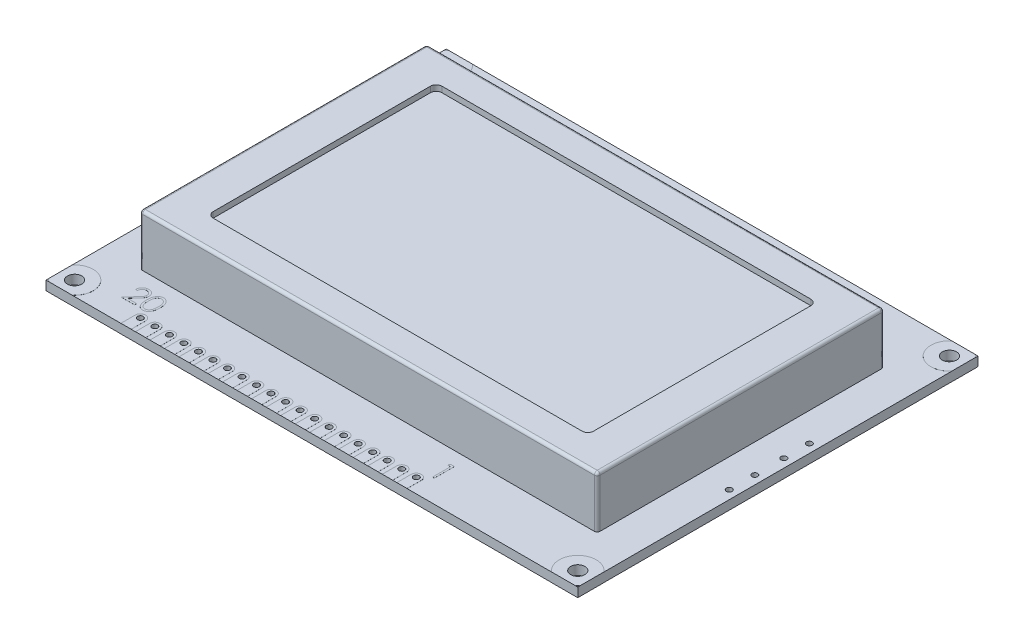
from build123d import *

# Parameters (mm, degrees)
SKETCH1_W                = 93
SKETCH1_H                = 70
SKETCH1_R                = 1.25
SKETCH1_R_2              = 0.5
BOSS_EXTRUDE1_DEPTH      = 1.6
BOSS_EXTRUDE2_DEPTH      = 1.61
BOSS_EXTRUDE2_DEPTH_BACK = 0.01
SKETCH4_R                = 0.5
SKETCH4_R_2              = 1.25
BOSS_EXTRUDE3_START      = 1.6
SKETCH5_W                = 80
SKETCH5_H                = 50.2
BOSS_EXTRUDE3_DEPTH      = 9
FILLET1_R                = 0.5
CUT_EXTRUDE1_START       = 10.6
CUT_EXTRUDE1_DEPTH       = 1
BOSS_EXTRUDE4_START      = 1.6
BOSS_EXTRUDE4_DEPTH      = 0.01
SKETCH8_R                = 7.5
BOSS_EXTRUDE5_DEPTH      = 3
FILLET2_R                = 9


with BuildPart() as part:
    # Sketch1 → Boss-Extrude1 (new body)
    with BuildSketch(Plane(origin=(0, 0, 0), x_dir=(1, 0, 0), z_dir=(0, 1, 0))):
        with Locations((46.5, 35)):
            Rectangle(SKETCH1_W, SKETCH1_H)
        with Locations(Location((2.5, 67.5, 0), (0, 0, 270))):
            Circle(SKETCH1_R, mode=Mode.SUBTRACT)
        with Locations(Location((90.5, 67.5, 0), (0, 0, 270))):
            Circle(SKETCH1_R, mode=Mode.SUBTRACT)
        with Locations(Location((90.5, 2.5, 0), (0, 0, 270))):
            Circle(SKETCH1_R, mode=Mode.SUBTRACT)
        with Locations(Location((2.5, 2.5, 0), (0, 0, 270))):
            Circle(SKETCH1_R, mode=Mode.SUBTRACT)
        with Locations(Location((14, 2.5, 0), (0, 0, 270))):
            Circle(SKETCH1_R_2, mode=Mode.SUBTRACT)
        with Locations(Location((16.54, 2.5, 0), (0, 0, 270))):
            Circle(SKETCH1_R_2, mode=Mode.SUBTRACT)
        with Locations(Location((19.08, 2.5, 0), (0, 0, 270))):
            Circle(SKETCH1_R_2, mode=Mode.SUBTRACT)
        with Locations(Location((21.62, 2.5, 0), (0, 0, 270))):
            Circle(SKETCH1_R_2, mode=Mode.SUBTRACT)
        with Locations(Location((24.16, 2.5, 0), (0, 0, 270))):
            Circle(SKETCH1_R_2, mode=Mode.SUBTRACT)
        with Locations(Location((26.7, 2.5, 0), (0, 0, 270))):
            Circle(SKETCH1_R_2, mode=Mode.SUBTRACT)
        with Locations(Location((29.24, 2.5, 0), (0, 0, 270))):
            Circle(SKETCH1_R_2, mode=Mode.SUBTRACT)
        with Locations(Location((31.78, 2.5, 0), (0, 0, 270))):
            Circle(SKETCH1_R_2, mode=Mode.SUBTRACT)
        with Locations(Location((34.32, 2.5, 0), (0, 0, 270))):
            Circle(SKETCH1_R_2, mode=Mode.SUBTRACT)
        with Locations(Location((36.86, 2.5, 0), (0, 0, 270))):
            Circle(SKETCH1_R_2, mode=Mode.SUBTRACT)
        with Locations(Location((39.4, 2.5, 0), (0, 0, 270))):
            Circle(SKETCH1_R_2, mode=Mode.SUBTRACT)
        with Locations(Location((41.94, 2.5, 0), (0, 0, 270))):
            Circle(SKETCH1_R_2, mode=Mode.SUBTRACT)
        with Locations(Location((44.48, 2.5, 0), (0, 0, 270))):
            Circle(SKETCH1_R_2, mode=Mode.SUBTRACT)
        with Locations(Location((47.02, 2.5, 0), (0, 0, 270))):
            Circle(SKETCH1_R_2, mode=Mode.SUBTRACT)
        with Locations(Location((49.56, 2.5, 0), (0, 0, 270))):
            Circle(SKETCH1_R_2, mode=Mode.SUBTRACT)
        with Locations(Location((52.1, 2.5, 0), (0, 0, 270))):
            Circle(SKETCH1_R_2, mode=Mode.SUBTRACT)
        with Locations(Location((54.64, 2.5, 0), (0, 0, 270))):
            Circle(SKETCH1_R_2, mode=Mode.SUBTRACT)
        with Locations(Location((57.18, 2.5, 0), (0, 0, 270))):
            Circle(SKETCH1_R_2, mode=Mode.SUBTRACT)
        with Locations(Location((59.72, 2.5, 0), (0, 0, 270))):
            Circle(SKETCH1_R_2, mode=Mode.SUBTRACT)
        with Locations(Location((62.26, 2.5, 0), (0, 0, 270))):
            Circle(SKETCH1_R_2, mode=Mode.SUBTRACT)
        with Locations(Location((91.5, 42, 0), (0, 0, 270))):
            Circle(SKETCH1_R_2, mode=Mode.SUBTRACT)
        with Locations(Location((91.5, 37.54, 0), (0, 0, 270))):
            Circle(SKETCH1_R_2, mode=Mode.SUBTRACT)
        with Locations(Location((91.5, 32.46, 0), (0, 0, 270))):
            Circle(SKETCH1_R_2, mode=Mode.SUBTRACT)
        with Locations(Location((91.5, 28, 0), (0, 0, 270))):
            Circle(SKETCH1_R_2, mode=Mode.SUBTRACT)
    extrude(amount=BOSS_EXTRUDE1_DEPTH)

    # Sketch4 → Boss-Extrude2 (add, two sides: drawn at the far end of the back side and taken through both)
    # profile 1 of 24: a face of its own
    with BuildSketch(Plane(origin=(0, 0, 0), x_dir=(1, 0, 0), z_dir=(0, 1, 0)).offset(-BOSS_EXTRUDE2_DEPTH_BACK)):
        with BuildLine():
            Line((13.1, 2.5), (13.1, 0))
            Line((13.1, 0), (14.9, 0))
            Line((14.9, 0), (14.9, 2.5))
            ThreePointArc((14.9, 2.5), (14, 3.4), (13.1, 2.5))
        make_face()
        with Locations(Location((14, 2.5, 0), (0, 0, 270))):
            Circle(SKETCH4_R, mode=Mode.SUBTRACT)
    # profile 2 of 24: a face of its own
    with BuildSketch(Plane(origin=(0, 0, 0), x_dir=(1, 0, 0), z_dir=(0, 1, 0)).offset(-BOSS_EXTRUDE2_DEPTH_BACK)):
        with BuildLine():
            Line((15.64, 2.5), (15.64, 0))
            Line((15.64, 0), (17.44, 0))
            Line((17.44, 0), (17.44, 2.5))
            ThreePointArc((17.44, 2.5), (16.54, 3.4), (15.64, 2.5))
        make_face()
        with Locations(Location((16.54, 2.5, 0), (0, 0, 270))):
            Circle(SKETCH4_R, mode=Mode.SUBTRACT)
    # profile 3 of 24: a face of its own
    with BuildSketch(Plane(origin=(0, 0, 0), x_dir=(1, 0, 0), z_dir=(0, 1, 0)).offset(-BOSS_EXTRUDE2_DEPTH_BACK)):
        with BuildLine():
            Line((18.18, 2.5), (18.18, 0))
            Line((18.18, 0), (19.98, 0))
            Line((19.98, 0), (19.98, 2.5))
            ThreePointArc((19.98, 2.5), (19.08, 3.4), (18.18, 2.5))
        make_face()
        with Locations(Location((19.08, 2.5, 0), (0, 0, 270))):
            Circle(SKETCH4_R, mode=Mode.SUBTRACT)
    # profile 4 of 24: a face of its own
    with BuildSketch(Plane(origin=(0, 0, 0), x_dir=(1, 0, 0), z_dir=(0, 1, 0)).offset(-BOSS_EXTRUDE2_DEPTH_BACK)):
        with BuildLine():
            Line((20.72, 2.5), (20.72, 0))
            Line((20.72, 0), (22.52, 0))
            Line((22.52, 0), (22.52, 2.5))
            ThreePointArc((22.52, 2.5), (21.62, 3.4), (20.72, 2.5))
        make_face()
        with Locations(Location((21.62, 2.5, 0), (0, 0, 270))):
            Circle(SKETCH4_R, mode=Mode.SUBTRACT)
    # profile 5 of 24: a face of its own
    with BuildSketch(Plane(origin=(0, 0, 0), x_dir=(1, 0, 0), z_dir=(0, 1, 0)).offset(-BOSS_EXTRUDE2_DEPTH_BACK)):
        with BuildLine():
            Line((23.26, 2.5), (23.26, 0))
            Line((23.26, 0), (25.06, 0))
            Line((25.06, 0), (25.06, 2.5))
            ThreePointArc((25.06, 2.5), (24.16, 3.4), (23.26, 2.5))
        make_face()
        with Locations(Location((24.16, 2.5, 0), (0, 0, 270))):
            Circle(SKETCH4_R, mode=Mode.SUBTRACT)
    # profile 6 of 24: a face of its own
    with BuildSketch(Plane(origin=(0, 0, 0), x_dir=(1, 0, 0), z_dir=(0, 1, 0)).offset(-BOSS_EXTRUDE2_DEPTH_BACK)):
        with BuildLine():
            Line((25.8, 2.5), (25.8, 0))
            Line((25.8, 0), (27.6, 0))
            Line((27.6, 0), (27.6, 2.5))
            ThreePointArc((27.6, 2.5), (26.7, 3.4), (25.8, 2.5))
        make_face()
        with Locations(Location((26.7, 2.5, 0), (0, 0, 270))):
            Circle(SKETCH4_R, mode=Mode.SUBTRACT)
    # profile 7 of 24: a face of its own
    with BuildSketch(Plane(origin=(0, 0, 0), x_dir=(1, 0, 0), z_dir=(0, 1, 0)).offset(-BOSS_EXTRUDE2_DEPTH_BACK)):
        with BuildLine():
            Line((28.34, 2.5), (28.34, 0))
            Line((28.34, 0), (30.14, 0))
            Line((30.14, 0), (30.14, 2.5))
            ThreePointArc((30.14, 2.5), (29.24, 3.4), (28.34, 2.5))
        make_face()
        with Locations(Location((29.24, 2.5, 0), (0, 0, 270))):
            Circle(SKETCH4_R, mode=Mode.SUBTRACT)
    # profile 8 of 24: a face of its own
    with BuildSketch(Plane(origin=(0, 0, 0), x_dir=(1, 0, 0), z_dir=(0, 1, 0)).offset(-BOSS_EXTRUDE2_DEPTH_BACK)):
        with BuildLine():
            Line((30.88, 2.5), (30.88, 0))
            Line((30.88, 0), (32.68, 0))
            Line((32.68, 0), (32.68, 2.5))
            ThreePointArc((32.68, 2.5), (31.78, 3.4), (30.88, 2.5))
        make_face()
        with Locations(Location((31.78, 2.5, 0), (0, 0, 270))):
            Circle(SKETCH4_R, mode=Mode.SUBTRACT)
    # profile 9 of 24: a face of its own
    with BuildSketch(Plane(origin=(0, 0, 0), x_dir=(1, 0, 0), z_dir=(0, 1, 0)).offset(-BOSS_EXTRUDE2_DEPTH_BACK)):
        with BuildLine():
            Line((33.42, 2.5), (33.42, 0))
            Line((33.42, 0), (35.22, 0))
            Line((35.22, 0), (35.22, 2.5))
            ThreePointArc((35.22, 2.5), (34.32, 3.4), (33.42, 2.5))
        make_face()
        with Locations(Location((34.32, 2.5, 0), (0, 0, 270))):
            Circle(SKETCH4_R, mode=Mode.SUBTRACT)
    # profile 10 of 24: a face of its own
    with BuildSketch(Plane(origin=(0, 0, 0), x_dir=(1, 0, 0), z_dir=(0, 1, 0)).offset(-BOSS_EXTRUDE2_DEPTH_BACK)):
        with BuildLine():
            Line((35.96, 2.5), (35.96, 0))
            Line((35.96, 0), (37.76, 0))
            Line((37.76, 0), (37.76, 2.5))
            ThreePointArc((37.76, 2.5), (36.86, 3.4), (35.96, 2.5))
        make_face()
        with Locations(Location((36.86, 2.5, 0), (0, 0, 270))):
            Circle(SKETCH4_R, mode=Mode.SUBTRACT)
    # profile 11 of 24: a face of its own
    with BuildSketch(Plane(origin=(0, 0, 0), x_dir=(1, 0, 0), z_dir=(0, 1, 0)).offset(-BOSS_EXTRUDE2_DEPTH_BACK)):
        with BuildLine():
            Line((38.5, 2.5), (38.5, 0))
            Line((38.5, 0), (40.3, 0))
            Line((40.3, 0), (40.3, 2.5))
            ThreePointArc((40.3, 2.5), (39.4, 3.4), (38.5, 2.5))
        make_face()
        with Locations(Location((39.4, 2.5, 0), (0, 0, 270))):
            Circle(SKETCH4_R, mode=Mode.SUBTRACT)
    # profile 12 of 24: a face of its own
    with BuildSketch(Plane(origin=(0, 0, 0), x_dir=(1, 0, 0), z_dir=(0, 1, 0)).offset(-BOSS_EXTRUDE2_DEPTH_BACK)):
        with BuildLine():
            Line((41.04, 2.5), (41.04, 0))
            Line((41.04, 0), (42.84, 0))
            Line((42.84, 0), (42.84, 2.5))
            ThreePointArc((42.84, 2.5), (41.94, 3.4), (41.04, 2.5))
        make_face()
        with Locations(Location((41.94, 2.5, 0), (0, 0, 270))):
            Circle(SKETCH4_R, mode=Mode.SUBTRACT)
    # profile 13 of 24: a face of its own
    with BuildSketch(Plane(origin=(0, 0, 0), x_dir=(1, 0, 0), z_dir=(0, 1, 0)).offset(-BOSS_EXTRUDE2_DEPTH_BACK)):
        with BuildLine():
            Line((43.58, 2.5), (43.58, 0))
            Line((43.58, 0), (45.38, 0))
            Line((45.38, 0), (45.38, 2.5))
            ThreePointArc((45.38, 2.5), (44.48, 3.4), (43.58, 2.5))
        make_face()
        with Locations(Location((44.48, 2.5, 0), (0, 0, 270))):
            Circle(SKETCH4_R, mode=Mode.SUBTRACT)
    # profile 14 of 24: a face of its own
    with BuildSketch(Plane(origin=(0, 0, 0), x_dir=(1, 0, 0), z_dir=(0, 1, 0)).offset(-BOSS_EXTRUDE2_DEPTH_BACK)):
        with BuildLine():
            Line((46.12, 2.5), (46.12, 0))
            Line((46.12, 0), (47.92, 0))
            Line((47.92, 0), (47.92, 2.5))
            ThreePointArc((47.92, 2.5), (47.02, 3.4), (46.12, 2.5))
        make_face()
        with Locations(Location((47.02, 2.5, 0), (0, 0, 270))):
            Circle(SKETCH4_R, mode=Mode.SUBTRACT)
    # profile 15 of 24: a face of its own
    with BuildSketch(Plane(origin=(0, 0, 0), x_dir=(1, 0, 0), z_dir=(0, 1, 0)).offset(-BOSS_EXTRUDE2_DEPTH_BACK)):
        with BuildLine():
            Line((48.66, 2.5), (48.66, 0))
            Line((48.66, 0), (50.46, 0))
            Line((50.46, 0), (50.46, 2.5))
            ThreePointArc((50.46, 2.5), (49.56, 3.4), (48.66, 2.5))
        make_face()
        with Locations(Location((49.56, 2.5, 0), (0, 0, 270))):
            Circle(SKETCH4_R, mode=Mode.SUBTRACT)
    # profile 16 of 24: a face of its own
    with BuildSketch(Plane(origin=(0, 0, 0), x_dir=(1, 0, 0), z_dir=(0, 1, 0)).offset(-BOSS_EXTRUDE2_DEPTH_BACK)):
        with BuildLine():
            Line((51.2, 2.5), (51.2, 0))
            Line((51.2, 0), (53, 0))
            Line((53, 0), (53, 2.5))
            ThreePointArc((53, 2.5), (52.1, 3.4), (51.2, 2.5))
        make_face()
        with Locations(Location((52.1, 2.5, 0), (0, 0, 270))):
            Circle(SKETCH4_R, mode=Mode.SUBTRACT)
    # profile 17 of 24: a face of its own
    with BuildSketch(Plane(origin=(0, 0, 0), x_dir=(1, 0, 0), z_dir=(0, 1, 0)).offset(-BOSS_EXTRUDE2_DEPTH_BACK)):
        with BuildLine():
            Line((53.74, 2.5), (53.74, 0))
            Line((53.74, 0), (55.54, 0))
            Line((55.54, 0), (55.54, 2.5))
            ThreePointArc((55.54, 2.5), (54.64, 3.4), (53.74, 2.5))
        make_face()
        with Locations(Location((54.64, 2.5, 0), (0, 0, 270))):
            Circle(SKETCH4_R, mode=Mode.SUBTRACT)
    # profile 18 of 24: a face of its own
    with BuildSketch(Plane(origin=(0, 0, 0), x_dir=(1, 0, 0), z_dir=(0, 1, 0)).offset(-BOSS_EXTRUDE2_DEPTH_BACK)):
        with BuildLine():
            Line((56.28, 2.5), (56.28, 0))
            Line((56.28, 0), (58.08, 0))
            Line((58.08, 0), (58.08, 2.5))
            ThreePointArc((58.08, 2.5), (57.18, 3.4), (56.28, 2.5))
        make_face()
        with Locations(Location((57.18, 2.5, 0), (0, 0, 270))):
            Circle(SKETCH4_R, mode=Mode.SUBTRACT)
    # profile 19 of 24: a face of its own
    with BuildSketch(Plane(origin=(0, 0, 0), x_dir=(1, 0, 0), z_dir=(0, 1, 0)).offset(-BOSS_EXTRUDE2_DEPTH_BACK)):
        with BuildLine():
            Line((58.82, 2.5), (58.82, 0))
            Line((58.82, 0), (60.62, 0))
            Line((60.62, 0), (60.62, 2.5))
            ThreePointArc((60.62, 2.5), (59.72, 3.4), (58.82, 2.5))
        make_face()
        with Locations(Location((59.72, 2.5, 0), (0, 0, 270))):
            Circle(SKETCH4_R, mode=Mode.SUBTRACT)
    # profile 20 of 24: a face of its own
    with BuildSketch(Plane(origin=(0, 0, 0), x_dir=(1, 0, 0), z_dir=(0, 1, 0)).offset(-BOSS_EXTRUDE2_DEPTH_BACK)):
        with BuildLine():
            Line((61.36, 2.5), (61.36, 0))
            Line((61.36, 0), (63.16, 0))
            Line((63.16, 0), (63.16, 2.5))
            ThreePointArc((63.16, 2.5), (62.26, 3.4), (61.36, 2.5))
        make_face()
        with Locations(Location((62.26, 2.5, 0), (0, 0, 270))):
            Circle(SKETCH4_R, mode=Mode.SUBTRACT)
    # profile 21 of 24: a face of its own
    with BuildSketch(Plane(origin=(0, 0, 0), x_dir=(1, 0, 0), z_dir=(0, 1, 0)).offset(-BOSS_EXTRUDE2_DEPTH_BACK)):
        with BuildLine():
            Line((0, 4.576655966), (0, 0.423344034))
            ThreePointArc((0, 0.423344034), (0.201902961, 0.201902961), (0.423344034, 0))
            Line((0.423344034, 0), (4.576655966, 0))
            ThreePointArc((4.576655966, 0), (4.798097039, 4.798097039), (0, 4.576655966))
        make_face()
        with Locations(Location((2.5, 2.5, 0), (0, 0, 270))):
            Circle(SKETCH4_R_2, mode=Mode.SUBTRACT)
    # profile 22 of 24: a face of its own
    with BuildSketch(Plane(origin=(0, 0, 0), x_dir=(1, 0, 0), z_dir=(0, 1, 0)).offset(-BOSS_EXTRUDE2_DEPTH_BACK)):
        with BuildLine():
            Line((4.576655966, 70), (0.423344034, 70))
            ThreePointArc((0.423344034, 70), (0.201902961, 69.798097039), (0, 69.576655966))
            Line((0, 69.576655966), (0, 65.423344034))
            ThreePointArc((0, 65.423344034), (4.798097039, 65.201902961), (4.576655966, 70))
        make_face()
        with Locations(Location((2.5, 67.5, 0), (0, 0, 270))):
            Circle(SKETCH4_R_2, mode=Mode.SUBTRACT)
    # profile 23 of 24: a face of its own
    with BuildSketch(Plane(origin=(0, 0, 0), x_dir=(1, 0, 0), z_dir=(0, 1, 0)).offset(-BOSS_EXTRUDE2_DEPTH_BACK)):
        with BuildLine():
            Line((88.423344034, 70), (92.576655966, 70))
            ThreePointArc((92.576655966, 70), (92.798097039, 69.798097039), (93, 69.576655966))
            Line((93, 69.576655966), (93, 65.423344034))
            ThreePointArc((93, 65.423344034), (88.201902961, 65.201902961), (88.423344034, 70))
        make_face()
        with Locations(Location((90.5, 67.5, 0), (0, 0, 270))):
            Circle(SKETCH4_R_2, mode=Mode.SUBTRACT)
    # profile 24 of 24: a face of its own
    with BuildSketch(Plane(origin=(0, 0, 0), x_dir=(1, 0, 0), z_dir=(0, 1, 0)).offset(-BOSS_EXTRUDE2_DEPTH_BACK)):
        with BuildLine():
            Line((88.423344034, 0), (92.576655966, 0))
            ThreePointArc((92.576655966, 0), (92.798097039, 0.201902961), (93, 0.423344034))
            Line((93, 0.423344034), (93, 4.576655966))
            ThreePointArc((93, 4.576655966), (88.201902961, 4.798097039), (88.423344034, 0))
        make_face()
        with Locations(Location((90.5, 2.5, 0), (0, 0, 270))):
            Circle(SKETCH4_R_2, mode=Mode.SUBTRACT)
    extrude(amount=BOSS_EXTRUDE2_DEPTH + BOSS_EXTRUDE2_DEPTH_BACK)

    # Sketch5 → Boss-Extrude3 (add)
    with BuildSketch(Plane(origin=(0, 0, 0), x_dir=(1, 0, 0), z_dir=(0, 1, 0)).offset(BOSS_EXTRUDE3_START)):
        with Locations((46.5, 35)):
            Rectangle(SKETCH5_W, SKETCH5_H)
    extrude(amount=BOSS_EXTRUDE3_DEPTH)

    # Fillet1
    fillet1_edges = [part.edges().sort_by_distance(p)[0] for p in [
        (6.5, 6.1, -9.9),
        (86.5, 6.1, -9.9),
        (86.5, 6.1, -60.1),
        (6.5, 6.1, -60.1),
        (46.5, 10.6, -9.9),
        (86.5, 10.6, -35),
        (46.5, 10.6, -60.1),
        (6.5, 10.6, -35),
    ]]
    fillet(fillet1_edges, radius=FILLET1_R)

    # Sketch6 → Cut-Extrude1 (cut)
    with BuildSketch(Plane(origin=(0, 0, 0), x_dir=(1, 0, 0), z_dir=(0, 1, 0)).offset(CUT_EXTRUDE1_START)):
        with BuildLine():
            Line((14.24, 55), (78.76, 55))
            ThreePointArc((78.76, 55), (79.467106781, 54.707106781), (79.76, 54))
            Line((79.76, 54), (79.76, 16))
            ThreePointArc((79.76, 16), (79.467106781, 15.292893219), (78.76, 15))
            Line((78.76, 15), (14.24, 15))
            ThreePointArc((14.24, 15), (13.532893219, 15.292893219), (13.24, 16))
            Line((13.24, 16), (13.24, 54))
            ThreePointArc((13.24, 54), (13.532893219, 54.707106781), (14.24, 55))
        make_face()
    extrude(amount=-CUT_EXTRUDE1_DEPTH, mode=Mode.SUBTRACT)

    # Sketch7 → Boss-Extrude4 (add)
    # profile 1 of 3: a face of its own
    with BuildSketch(Plane(origin=(0, 0, 0), x_dir=(1, 0, 0), z_dir=(0, 1, 0)).offset(BOSS_EXTRUDE4_START)):
        Polygon((63.31493189, 7.465834386), (63.962067306, 7.465834386), (63.962067306, 3.965834386), (63.647964742, 3.965834386), (63.647964742, 7.106860027), (63.109503204, 7.106860027), align=None)
    # profile 2 of 3: a face of its own
    with BuildSketch(Plane(origin=(0, 0, 0), x_dir=(1, 0, 0), z_dir=(0, 1, 0)).offset(BOSS_EXTRUDE4_START)):
        with BuildLine():
            Line((9.57822358, 6.421604631), (9.264121016, 6.421604631))
            add(Edge.make_bspline(
                [(9.264121016, 6.421604631), (9.266168169, 6.463275519), (9.270188723, 6.545116033), (9.289017012, 6.66443994), (9.315957889, 6.778494738), (9.354049343, 6.886364652), (9.401355621, 6.98900346), (9.458085649, 7.086003475), (9.525279499, 7.176994664), (9.601486233, 7.261133507), (9.684254872, 7.338321078), (9.773560812, 7.404976321), (9.867405839, 7.461293992), (9.965505238, 7.508375234), (10.068965801, 7.54371508), (10.176848659, 7.56993672), (10.289627796, 7.585713065), (10.366467818, 7.587408851), (10.405547298, 7.588271298)],
                knots=[0, 0, 0, 0, 1.10065271, 2.161652631, 3.183658789, 4.190468796, 5.17591951, 6.163126047, 7.15150782, 8.156236427, 9.156009102, 10.134482811, 11.092018607, 12.041330605, 13.001268258, 13.972401359, 14.968799086, 16, 16, 16, 16], degree=3))
            add(Edge.make_bspline(
                [(10.405547298, 7.588271298), (10.443925372, 7.587372841), (10.519336917, 7.585607406), (10.629398931, 7.570446377), (10.734176226, 7.546700786), (10.833463992, 7.513385369), (10.926470057, 7.468600942), (11.013893101, 7.414803403), (11.096773912, 7.352583572), (11.171380696, 7.279329758), (11.239888775, 7.201127374), (11.29899103, 7.11763947), (11.349604194, 7.031410185), (11.391791873, 6.941781983), (11.422848012, 6.847910955), (11.44642622, 6.751163752), (11.459753634, 6.650538941), (11.461799058, 6.582432385), (11.462838965, 6.547806554)],
                knots=[0, 0, 0, 0, 1.111607364, 2.184268762, 3.212621178, 4.221274766, 5.211760367, 6.196651075, 7.1921475, 8.207485113, 9.220403448, 10.201281604, 11.166441695, 12.114753415, 13.065576456, 14.026450734, 14.996634279, 16, 16, 16, 16], degree=3))
            add(Edge.make_bspline(
                [(11.462838965, 6.547806554), (11.461145702, 6.49905872), (11.45778889, 6.402418506), (11.429074514, 6.260403643), (11.384228003, 6.122810224), (11.330230646, 6.012072922), (11.275758202, 5.922839428), (11.226670694, 5.849370723), (11.169205883, 5.770265255), (11.102527385, 5.685787917), (11.028014513, 5.595277012), (10.94499235, 5.498787217), (10.852868868, 5.397315447), (10.788210367, 5.328009846), (10.754705952, 5.292097419)],
                knots=[0, 0, 0, 0, 1.184426356, 2.348067706, 3.509069118, 4.696110526, 5.333549288, 6.050745305, 6.844228056, 7.710549037, 8.667450064, 9.695053472, 10.805634456, 12, 12, 12, 12], degree=3))
            Line((10.754705952, 5.292097419), (9.87900483, 4.357502067))
            Line((9.87900483, 4.357502067), (11.50771076, 4.357502067))
            Line((11.50771076, 4.357502067), (11.50771076, 3.998527708))
            Line((11.50771076, 3.998527708), (9.129505631, 3.998527708))
            Line((9.129505631, 3.998527708), (10.486877426, 5.447045336))
            add(Edge.make_bspline(
                [(10.486877426, 5.447045336), (10.519925313, 5.481543643), (10.58340354, 5.547807829), (10.673186117, 5.644550789), (10.753825105, 5.73430033), (10.825842498, 5.816886879), (10.887676003, 5.893518446), (10.942548235, 5.96171315), (10.986513826, 6.0244676), (11.034229222, 6.097208214), (11.080443203, 6.186020531), (11.120155559, 6.294554221), (11.144370408, 6.406281473), (11.147275243, 6.48178351), (11.148736401, 6.519761682)],
                knots=[0, 0, 0, 0, 1.329631726, 2.553950428, 3.673215718, 4.687767853, 5.603093632, 6.413772471, 7.123043292, 7.734684054, 8.834405432, 9.900288307, 10.943827018, 12, 12, 12, 12], degree=3))
            add(Edge.make_bspline(
                [(11.148736401, 6.519761682), (11.148100658, 6.543643081), (11.146847732, 6.590708731), (11.135790035, 6.65971449), (11.119079529, 6.726279304), (11.095134271, 6.790607923), (11.063527531, 6.852053575), (11.025054151, 6.910691055), (10.980664087, 6.96738002), (10.929312818, 7.020533319), (10.872901298, 7.069214524), (10.813307048, 7.112338609), (10.750256944, 7.14837772), (10.684016822, 7.177921217), (10.614771353, 7.201096599), (10.542386608, 7.217155178), (10.467062591, 7.227237662), (10.415629096, 7.228601834), (10.389421497, 7.229296939)],
                knots=[0, 0, 0, 0, 0.991446411, 1.95395049, 2.89581595, 3.838931463, 4.798493298, 5.75982156, 6.748411868, 7.785213223, 8.824556874, 9.840280684, 10.836137867, 11.835679398, 12.848801643, 13.863922112, 14.911575587, 16, 16, 16, 16], degree=3))
            add(Edge.make_bspline(
                [(10.389421497, 7.229296939), (10.362050664, 7.228581906), (10.308298868, 7.227177701), (10.229379835, 7.217355037), (10.154094057, 7.200409197), (10.082252154, 7.177232522), (10.013732568, 7.147773974), (9.948868524, 7.111082229), (9.887805635, 7.067298736), (9.830429112, 7.017658179), (9.777565133, 6.962390578), (9.731118257, 6.900780615), (9.690534243, 6.8339532), (9.655125009, 6.762088649), (9.626369319, 6.684534869), (9.604396169, 6.601567164), (9.587009322, 6.513545783), (9.581200801, 6.452760698), (9.57822358, 6.421604631)],
                knots=[0, 0, 0, 0, 1.031018746, 2.02475058, 2.990194455, 3.934040569, 4.864654155, 5.795059489, 6.735614925, 7.690564532, 8.649604399, 9.611025574, 10.590972636, 11.591080095, 12.624614302, 13.701020113, 14.821632451, 16, 16, 16, 16], degree=3))
        make_face()
    # profile 3 of 3: a face of its own
    with BuildSketch(Plane(origin=(0, 0, 0), x_dir=(1, 0, 0), z_dir=(0, 1, 0)).offset(BOSS_EXTRUDE4_START)):
        with BuildLine():
            add(Edge.make_bspline(
                [(11.821813324, 5.747125464), (11.822141342, 5.803222852), (11.822778522, 5.912192836), (11.829866943, 6.070977478), (11.841642285, 6.219937767), (11.857779658, 6.359080833), (11.877417638, 6.488442598), (11.903633125, 6.607677355), (11.933445927, 6.717336962), (11.967998373, 6.81777901), (12.006986162, 6.910356713), (12.049420423, 6.996781914), (12.096985217, 7.076923847), (12.14696213, 7.152061637), (12.201374202, 7.220965332), (12.258672992, 7.284607995), (12.321094869, 7.341518745), (12.386517877, 7.393365047), (12.455534341, 7.438814519), (12.526177007, 7.478847258), (12.598932113, 7.513047125), (12.673998296, 7.539937561), (12.750700854, 7.562148408), (12.829307921, 7.577337355), (12.909949285, 7.586894264), (12.964380719, 7.587807931), (12.991985599, 7.588271298)],
                knots=[0, 0, 0, 0, 1.646270934, 3.197905019, 4.663502075, 6.030701355, 7.308322542, 8.50163776, 9.611534131, 10.641858119, 11.616356847, 12.558055219, 13.465016945, 14.349605745, 15.204443733, 16.039544428, 16.859896111, 17.680448484, 18.487036065, 19.28249412, 20.06191084, 20.843045899, 21.620316918, 22.403196591, 23.190181807, 24, 24, 24, 24], degree=3))
            add(Edge.make_bspline(
                [(12.991985599, 7.588271298), (13.019821078, 7.587783483), (13.075177087, 7.586813372), (13.157017462, 7.577489429), (13.236967144, 7.562018306), (13.314685282, 7.540097331), (13.390810269, 7.512901655), (13.464746676, 7.478814538), (13.536953758, 7.43913567), (13.606284046, 7.392511793), (13.673498661, 7.340529517), (13.736946624, 7.281766848), (13.79663371, 7.216817129), (13.853309015, 7.146375265), (13.905364612, 7.06909018), (13.954938045, 6.98630607), (13.999310081, 6.896575205), (14.042044756, 6.801394738), (14.078931742, 6.698131079), (14.112197988, 6.587366318), (14.139076956, 6.467792131), (14.161466229, 6.340035886), (14.178811125, 6.203628403), (14.191443767, 6.058862087), (14.198116852, 5.905641697), (14.199373553, 5.800883847), (14.200018452, 5.747125464)],
                knots=[0, 0, 0, 0, 0.810914788, 1.612654377, 2.396697861, 3.181598691, 3.963628158, 4.749916497, 5.551656086, 6.361998678, 7.18212741, 8.025565596, 8.878627764, 9.750805457, 10.657531673, 11.591944965, 12.560506719, 13.57287815, 14.630710178, 15.753379473, 16.941251878, 18.199788006, 19.531962791, 20.947069417, 22.433333509, 24, 24, 24, 24], degree=3))
            add(Edge.make_bspline(
                [(14.200018452, 5.747125464), (14.199366867, 5.693601556), (14.198097281, 5.589312405), (14.191518575, 5.436781429), (14.178559943, 5.292783386), (14.162349955, 5.156972923), (14.139898992, 5.029915305), (14.112293826, 4.911170856), (14.081643503, 4.800226785), (14.043808709, 4.697991973), (14.002397999, 4.60304025), (13.957342802, 4.514373102), (13.909072976, 4.431206809), (13.856484231, 4.354207062), (13.800430818, 4.282828405), (13.739713029, 4.218330782), (13.676042444, 4.15916011), (13.608630028, 4.106508483), (13.538218477, 4.060423678), (13.4662594, 4.019209828), (13.391476017, 3.985977133), (13.315563064, 3.957442092), (13.237434698, 3.93564164), (13.157188307, 3.920567784), (13.075232071, 3.909995936), (13.019830506, 3.909189456), (12.991985599, 3.908784118)],
                knots=[0, 0, 0, 0, 1.561518951, 3.042555995, 4.452378317, 5.7783523, 7.031515105, 8.214008947, 9.334062868, 10.386615937, 11.391082383, 12.354592575, 13.286541444, 14.194233754, 15.072674879, 15.931287219, 16.775624067, 17.606195743, 18.42308326, 19.229000347, 20.022332153, 20.807536673, 21.593273796, 22.3848459, 23.188221202, 24, 24, 24, 24], degree=3))
            add(Edge.make_bspline(
                [(12.991985599, 3.908784118), (12.964381485, 3.909250474), (12.909951561, 3.910170036), (12.829299135, 3.919683767), (12.751016692, 3.93497927), (12.674717938, 3.956395874), (12.600011423, 3.982610711), (12.527915136, 4.016764394), (12.457627452, 4.056098463), (12.389335896, 4.100893885), (12.324323735, 4.152215568), (12.26222513, 4.208979857), (12.204600111, 4.272603268), (12.150966015, 4.342081191), (12.099991927, 4.416774433), (12.053102554, 4.497702806), (12.009731699, 4.584545417), (11.970088209, 4.677863327), (11.934939545, 4.779018255), (11.903891837, 4.889167434), (11.87937768, 5.00928307), (11.858394724, 5.138400437), (11.841470341, 5.277074367), (11.829916016, 5.425380146), (11.822774701, 5.583225355), (11.822139631, 5.691495129), (11.821813324, 5.747125464)],
                knots=[0, 0, 0, 0, 0.810891512, 1.598919785, 2.382837074, 3.152667961, 3.926044502, 4.706494248, 5.493654104, 6.291793342, 7.103789334, 7.925228297, 8.761435821, 9.622817696, 10.50288917, 11.416980706, 12.369136599, 13.353924996, 14.394355917, 15.514179734, 16.714354668, 17.994756427, 19.357759367, 20.818452758, 22.365282078, 24, 24, 24, 24], degree=3))
        make_face()
        with BuildLine():
            add(Edge.make_bspline(
                [(12.135915888, 5.748527708), (12.136035335, 5.701779009), (12.136267158, 5.611048964), (12.142323359, 5.479205703), (12.150573591, 5.356235375), (12.161214888, 5.241981838), (12.177017836, 5.136831826), (12.194724624, 5.040062143), (12.216272714, 4.952184905), (12.241767732, 4.872597095), (12.270806829, 4.799948026), (12.302512692, 4.732346811), (12.336573415, 4.668994875), (12.374692566, 4.610461266), (12.416207629, 4.556555102), (12.460180888, 4.50632227), (12.508253472, 4.461525289), (12.574757215, 4.407798433), (12.662553689, 4.3522793), (12.773174145, 4.30393321), (12.886842595, 4.273550754), (12.963993846, 4.269686998), (13.002502426, 4.267758477)],
                knots=[0, 0, 0, 0, 1.459021318, 2.831673884, 4.118529203, 5.306027144, 6.411944654, 7.436330062, 8.375795394, 9.233974572, 10.042671642, 10.816086306, 11.563610507, 12.285937304, 12.993564865, 13.685989202, 14.367179055, 15.041617293, 16.353048772, 17.594441528, 18.799311195, 20, 20, 20, 20], degree=3))
            add(Edge.make_bspline(
                [(13.002502426, 4.267758477), (13.041260098, 4.269356258), (13.118695421, 4.272548521), (13.231829216, 4.303347258), (13.341659486, 4.349816798), (13.427731427, 4.404764303), (13.49321397, 4.457092632), (13.54013096, 4.501707281), (13.583193009, 4.551663148), (13.624035083, 4.605562444), (13.661494159, 4.664434928), (13.695557297, 4.727997503), (13.726640644, 4.796426681), (13.74434969, 4.84419642), (13.753403868, 4.868619855)],
                knots=[0, 0, 0, 0, 1.353760809, 2.704726607, 4.075137775, 5.516104923, 6.260822281, 7.007110065, 7.778089737, 8.566572457, 9.372053459, 10.217411131, 11.088608312, 12, 12, 12, 12], degree=3))
            add(Edge.make_bspline(
                [(13.753403868, 4.868619855), (13.763955636, 4.899849595), (13.78538025, 4.963259359), (13.812992024, 5.061623011), (13.834737424, 5.164825775), (13.854300789, 5.272250892), (13.867653845, 5.384690593), (13.878401659, 5.501796977), (13.884732345, 5.623658339), (13.885517097, 5.70645333), (13.885915888, 5.748527708)],
                knots=[0, 0, 0, 0, 0.884706709, 1.796334032, 2.740027952, 3.714592787, 4.726048262, 5.777819803, 6.87074269, 8, 8, 8, 8], degree=3))
            add(Edge.make_bspline(
                [(13.885915888, 5.748527708), (13.885365698, 5.79059528), (13.884289411, 5.872888445), (13.880175423, 5.993406626), (13.869551849, 6.107874387), (13.85775273, 6.216784859), (13.840355509, 6.319535162), (13.821597702, 6.416985467), (13.796396489, 6.507928492), (13.769476714, 6.593788074), (13.738666319, 6.673588728), (13.704750585, 6.747702515), (13.668528826, 6.81648724), (13.629186585, 6.879754181), (13.587190902, 6.937786724), (13.541433353, 6.989421319), (13.49372898, 7.036258287), (13.426911795, 7.089720856), (13.339437505, 7.144232551), (13.230591857, 7.194398311), (13.117321213, 7.223206604), (13.040747759, 7.227268291), (13.002502426, 7.229296939)],
                knots=[0, 0, 0, 0, 1.31362396, 2.569729283, 3.763502607, 4.902122613, 5.988968491, 7.01645872, 7.998833611, 8.933434873, 9.825090667, 10.667526885, 11.477055099, 12.250526234, 12.991942729, 13.710640831, 14.402115721, 15.076753259, 16.378508321, 17.609869233, 18.806226677, 20, 20, 20, 20], degree=3))
            add(Edge.make_bspline(
                [(13.002502426, 7.229296939), (12.963791834, 7.227265492), (12.886300128, 7.223198898), (12.771852174, 7.194505644), (12.662147822, 7.144492678), (12.574904847, 7.089540306), (12.508041061, 7.037201995), (12.460958368, 6.99181554), (12.416812195, 6.942169286), (12.376144495, 6.887767371), (12.338055212, 6.829302004), (12.303074199, 6.766313239), (12.27155687, 6.698481875), (12.242472334, 6.62586544), (12.216899546, 6.546284495), (12.195805582, 6.458515502), (12.176318529, 6.36205361), (12.16252326, 6.256334102), (12.150259505, 6.142051948), (12.142378157, 6.01877463), (12.136246899, 5.88671025), (12.136028435, 5.795511091), (12.135915888, 5.748527708)],
                knots=[0, 0, 0, 0, 1.207732386, 2.417664972, 3.655092373, 4.956220595, 5.625982001, 6.301752483, 6.994047911, 7.697131622, 8.419323945, 9.170223765, 9.943494443, 10.752040957, 11.610060368, 12.549350801, 13.567764191, 14.679664412, 15.874934091, 17.154273443, 18.533957287, 20, 20, 20, 20], degree=3))
        make_face(mode=Mode.SUBTRACT)
    extrude(amount=BOSS_EXTRUDE4_DEPTH)

    # Sketch8 → Boss-Extrude5 (add)
    with BuildSketch(Plane(origin=(0, 0, 0), x_dir=(1, 0, 0), z_dir=(0, 1, 0))):
        with Locations(Location((19.375129734, 34.163780493, 0), (0, 0, 270))):
            Circle(SKETCH8_R)
        with Locations(Location((38.6081784, 39.285624975, 0), (0, 0, 270))):
            Circle(SKETCH8_R)
        with Locations(Location((59.304611205, 35.418109754, 0), (0, 0, 270))):
            Circle(SKETCH8_R)
    extrude(amount=-BOSS_EXTRUDE5_DEPTH)

    # Fillet2
    # the kernel refuses this fillet: 9 mm, written as the material it takes off along each edge
    with BuildSketch(Plane(origin=(19.375129734, -3, -34.163780493), x_dir=(0, 0, 1), z_dir=(-1, 0, 0))) as fillet2_piece_1:
        with BuildLine():
            CenterArc((0.791796068, 9), FILLET2_R, 270, 48.189685104)
            Line((0.791796068, 0), (0.791796068, -0.18))
            Line((0.791796068, -0.18), (7.5, -0.18))
            Line((7.5, -0.18), (7.68, 0))
            ThreePointArc((7.68, 0), (7.68, 1.5), (7.634164079, 2.88))
            Line((7.634164079, 2.88), (7.5, 3))
        make_face()
    revolve(axis=Axis((19.375129734, -3, -34.163780493), (0, 1, 0)), mode=Mode.SUBTRACT)
    with BuildSketch(Plane(origin=(38.6081784, -3, -39.285624975), x_dir=(0, 0, 1), z_dir=(-1, 0, 0))) as fillet2_piece_2:
        with BuildLine():
            CenterArc((0.791796068, 9), FILLET2_R, 270, 48.189685104)
            Line((0.791796068, 0), (0.791796068, -0.18))
            Line((0.791796068, -0.18), (7.5, -0.18))
            Line((7.5, -0.18), (7.68, 0))
            ThreePointArc((7.68, 0), (7.68, 1.5), (7.634164079, 2.88))
            Line((7.634164079, 2.88), (7.5, 3))
        make_face()
    revolve(axis=Axis((38.6081784, -3, -39.285624975), (0, 1, 0)), mode=Mode.SUBTRACT)
    with BuildSketch(Plane(origin=(59.304611205, -3, -35.418109754), x_dir=(0, 0, 1), z_dir=(-1, 0, 0))) as fillet2_piece_3:
        with BuildLine():
            CenterArc((0.791796068, 9), FILLET2_R, 270, 48.189685104)
            Line((0.791796068, 0), (0.791796068, -0.18))
            Line((0.791796068, -0.18), (7.5, -0.18))
            Line((7.5, -0.18), (7.68, 0))
            ThreePointArc((7.68, 0), (7.68, 1.5), (7.634164079, 2.88))
            Line((7.634164079, 2.88), (7.5, 3))
        make_face()
    revolve(axis=Axis((59.304611205, -3, -35.418109754), (0, 1, 0)), mode=Mode.SUBTRACT)


solid = part.part
